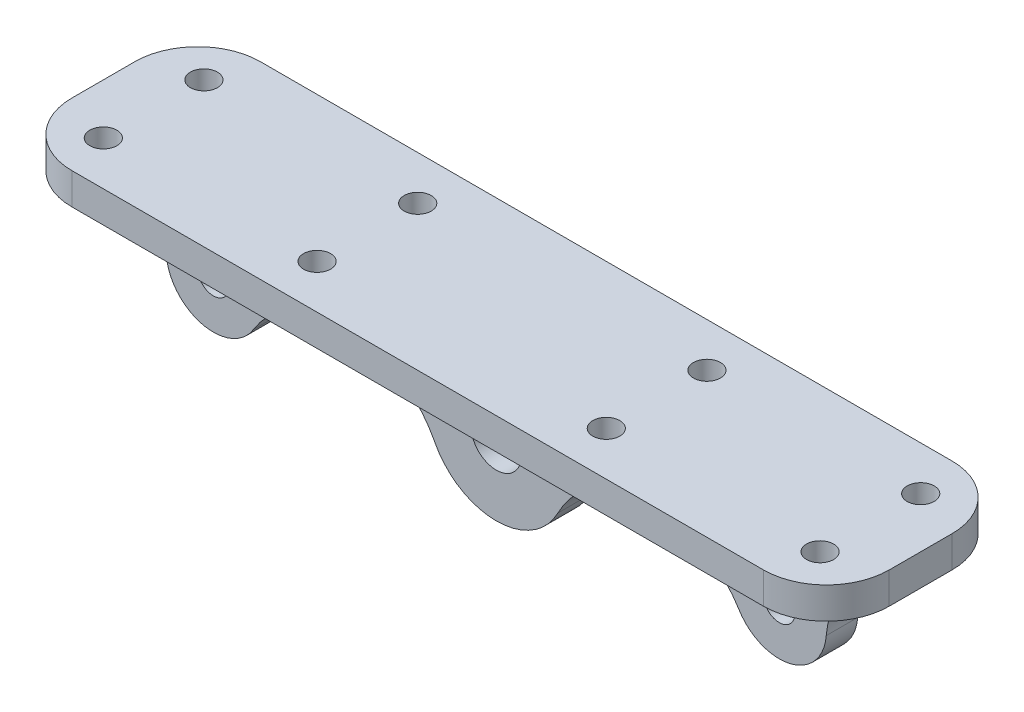
from build123d import *
from build123d.topology import SkipClean

# Parameters (mm, degrees)
SKETCH1_R                                = 2.5
BOSS_EXTRUDE1_DEPTH                      = 2.5
SKETCH4_W                                = 130
SKETCH4_H                                = 30
BOSS_EXTRUDE2_DEPTH                      = 5
FILLET1_R                                = 10
FILLET2_R                                = 12.5
SKETCH5_R                                = 2.15
CUT_EXTRUDE1_DEPTH                       = 10
BOSS_EXTRUDE3_DEPTH                      = 2.5
LPATTERN1_COUNT                          = 2
LPATTERN1_PITCH                          = 23
MIRROR4_COPY_1_DEPTH                     = 2.5
MIRROR4_AT_THE_SECOND_PLANE_COPY_1_DEPTH = 2.5
MIRROR4_AT_THE_SECOND_PLANE_COPY_2_DEPTH = 2.5
MIRROR4_AT_THE_SECOND_PLANE_COPY_3_DEPTH = 2.5


with BuildPart() as part:
    # Sketch1 → Boss-Extrude1 (new, symmetric)
    with BuildSketch(Plane.XY):
        with BuildLine():
            ThreePointArc((-38.614160498, -3.933326056), (-23.874667518, 3.933250754), (-9.779272654, -5.036449778))
            ThreePointArc((-9.779272654, -5.036449778), (-5.727087063, -9.391510729), (0, -11))
            Line((0, -11), (0, -4))
            ThreePointArc((0, -4), (-4, 0), (0, 4))
            Line((0, 4), (0, 11))
            Line((0, 11), (-52.5, 11))
            Line((-52.5, 11), (-52.5, 0))
            ThreePointArc((-52.5, 0), (-47.044040574, -7.216086067), (-38.614160498, -3.933326056))
        make_face()
        with Locations((-45, 0)):
            Circle(SKETCH1_R, mode=Mode.SUBTRACT)
    boss_extrude1 = extrude(amount=BOSS_EXTRUDE1_DEPTH, both=True)

    # Mirror1: Boss-Extrude1 across plane
    with SkipClean():  # the faces are left unmerged after this step: merging them gives an invalid solid
        add(boss_extrude1.mirror(Plane(origin=(0, 0, -2.5), x_dir=(0, 0, 1), z_dir=(-1, 0, 0))))

    # Sketch4 → Boss-Extrude2 (add)
    with SkipClean():  # the faces are left unmerged after this step: merging them gives an invalid solid
        with BuildSketch(Plane(origin=(0, 11, 0), x_dir=(1, 0, 0), z_dir=(0, 1, 0))):
            Rectangle(SKETCH4_W, SKETCH4_H)
        extrude(amount=BOSS_EXTRUDE2_DEPTH)

    # Fillet1
    fillet1_edges = [part.edges().sort_by_distance(p)[0] for p in [
        (-65, 13.5, -15),
        (-65, 13.5, 15),
        (65, 13.5, 15),
        (65, 13.5, -15),
    ]]
    fillet(fillet1_edges, radius=FILLET1_R)

    # Fillet2
    # the kernel refuses this fillet: 12.5 mm, written as the material it adds along each edge
    with BuildSketch(Plane(origin=(-52.5, 11, -2.5), x_dir=(-1, 0, 0), z_dir=(0, 0, 1))) as fillet2_piece_1:
        with BuildLine():
            CenterArc((12.443670675, 12.5), FILLET2_R, 184.301222305, 85.698777695)
            Line((-0.021123497, 11.5625), (-1.267602914, 11.46875))
            ThreePointArc((-1.267602914, 11.46875), (-1.25, 11), (-1.25, 0))
            Line((-1.25, 0), (0, -1.25))
            Line((0, -1.25), (12.443670675, -1.25))
            Line((12.443670675, -1.25), (12.443670675, 0))
        make_face()
    extrude(amount=5)
    with BuildSketch(Plane(origin=(52.5, 11, -2.5), x_dir=(1, 0, 0), z_dir=(0, 0, 1))) as fillet2_piece_2:
        with BuildLine():
            CenterArc((12.443670675, -12.5), FILLET2_R, 90, 85.698777695)
            Line((-0.021123497, -11.5625), (-1.267602914, -11.46875))
            ThreePointArc((-1.267602914, -11.46875), (-1.25, -11), (-1.25, 0))
            Line((-1.25, 0), (0, 1.25))
            Line((0, 1.25), (12.443670675, 1.25))
            Line((12.443670675, 1.25), (12.443670675, 0))
        make_face()
    extrude(amount=5)

    # Sketch5 → Cut-Extrude1 (cut)
    with BuildSketch(Plane(origin=(0, 16, 0), x_dir=(1, 0, 0), z_dir=(0, 1, 0))):
        with Locations(Location((-57, -8, 0), (0, 0, 180))):
            Circle(SKETCH5_R)
        with Locations(Location((-57, 8, 0), (0, 0, 180))):
            Circle(SKETCH5_R)
        with Locations(Location((-23, -8, 0), (0, 0, 180))):
            Circle(SKETCH5_R)
        with Locations(Location((-23, 8, 0), (0, 0, 180))):
            Circle(SKETCH5_R)
    cut_extrude1 = extrude(amount=-CUT_EXTRUDE1_DEPTH, mode=Mode.SUBTRACT)

    # Mirror2: Cut-Extrude1 across plane
    add(cut_extrude1.mirror(Plane(origin=(0, 0, 0), x_dir=(0, 0, 1), z_dir=(1, 0, 0))), mode=Mode.SUBTRACT)

    # Sketch7 → Boss-Extrude3 (add, symmetric)
    with BuildSketch(Plane(origin=(36.5, 0, 0), x_dir=(0, 0, -1), z_dir=(1, 0, 0))):
        Polygon((5, 11), (2.5, 11), (2.5, 6), (7.5, 11), align=None)
    boss_extrude3 = extrude(amount=BOSS_EXTRUDE3_DEPTH, both=True)

    # LPattern1: Boss-Extrude3 ×2
    with Locations(*[(-i * LPATTERN1_PITCH, 0, 0) for i in range(1, LPATTERN1_COUNT)]):
        add(boss_extrude3)

    # Mirror4: Boss-Extrude3 across plane
    add(boss_extrude3.mirror(Plane.XY))

    # Mirror4 copy 1 sketch → Mirror4 copy 1 (add, symmetric)
    with BuildSketch(Plane(origin=(13.5, 0, 0), x_dir=(0, 0, 1), z_dir=(1, 0, 0))):
        Polygon((5, -11), (2.5, -11), (2.5, -6), (7.5, -11), align=None)
    extrude(amount=MIRROR4_COPY_1_DEPTH, both=True)

    # Mirror4 at the second plane: Boss-Extrude3 across plane
    add(boss_extrude3.mirror(Plane(origin=(0, 0, 0), x_dir=(0, 0, 1), z_dir=(1, 0, 0))))

    # Mirror4 at the second plane copy 1 sketc → Mirror4 at the second plane copy 1 (add, symmetric)
    with BuildSketch(Plane(origin=(-13.5, 0, 0), x_dir=(0, 0, -1), z_dir=(-1, 0, 0))):
        Polygon((5, -11), (2.5, -11), (2.5, -6), (7.5, -11), align=None)
    extrude(amount=MIRROR4_AT_THE_SECOND_PLANE_COPY_1_DEPTH, both=True)

    # Mirror4 at the second plane copy 2 sketc → Mirror4 at the second plane copy 2 (add, symmetric)
    with BuildSketch(Plane.ZY.offset(36.5)):
        Polygon((5, 11), (2.5, 11), (2.5, 6), (7.5, 11), align=None)
    extrude(amount=MIRROR4_AT_THE_SECOND_PLANE_COPY_2_DEPTH, both=True)

    # Mirror4 at the second plane copy 3 sketc → Mirror4 at the second plane copy 3 (add, symmetric)
    with BuildSketch(Plane.ZY.offset(13.5)):
        Polygon((5, 11), (2.5, 11), (2.5, 6), (7.5, 11), align=None)
    extrude(amount=MIRROR4_AT_THE_SECOND_PLANE_COPY_3_DEPTH, both=True)


solid = part.part
